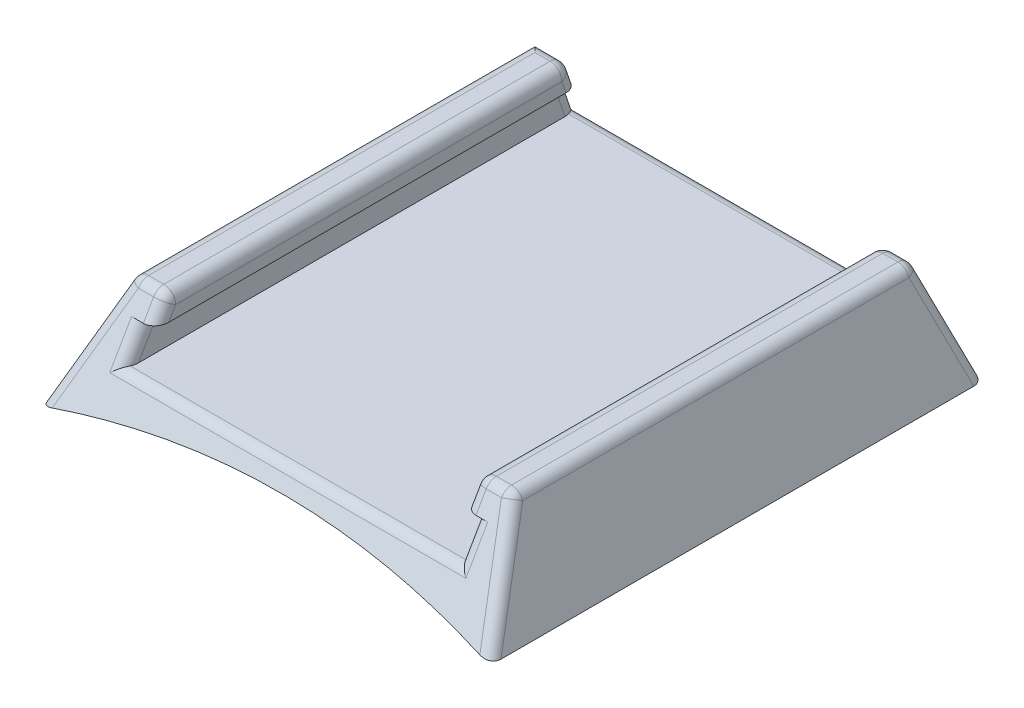
from build123d import *

# Parameters (mm, degrees)
BOSS_EXTRUDE1_DEPTH = 42
CUT_EXTRUDE2_DEPTH  = 58.425262324
FILLET1_R           = 1


with BuildPart() as part:
    # Sketch1 → Boss-Extrude1 (new body)
    with BuildSketch(Plane.XY):
        with BuildLine():
            Line((0, 0), (3, 8.626746371))
            Line((3, 8.626746371), (6, 8.626746371))
            Line((6, 8.626746371), (6, 6.626746371))
            Line((6, 6.626746371), (5, 6.626746371))
            Line((5, 6.626746371), (5, 3.926746371))
            Line((5, 3.926746371), (33.2, 3.926746371))
            Line((33.2, 3.926746371), (33.2, 6.626746371))
            Line((33.2, 6.626746371), (32.2, 6.626746371))
            Line((32.2, 6.626746371), (32.2, 8.626746371))
            Line((32.2, 8.626746371), (35.2, 8.626746371))
            Line((35.2, 8.626746371), (38.2, 0))
            ThreePointArc((38.2, 0), (19.1, 2.426746371), (0, 0))
        make_face()
    extrude(amount=BOSS_EXTRUDE1_DEPTH)

    # Sketch5 → Cut-Extrude2 (cut, through all)
    with BuildSketch(Plane(origin=(0, 0, 0), x_dir=(0, 0, -1), z_dir=(1, 0, 0))):
        Polygon((-42, 0), (-42, 8.626746371), (-37, 8.626746371), align=None)
        Polygon((0, 0), (0, 8.626746371), (-2.959406662, 8.626746371), align=None)
    extrude(amount=CUT_EXTRUDE2_DEPTH, mode=Mode.SUBTRACT)

    # Fillet1
    fillet1_edges = [part.edges().sort_by_distance(p)[0] for p in [
        (32.2, 7.626746371, 2.616356509),
        (33.2, 5.276746371, 1.81018865),
        (36.7, 4.313373185, 1.479703331),
        (33.7, 8.626746371, 2.959406662),
        (3, 8.626746371, 19.979703331),
        (4.5, 8.626746371, 2.959406662),
        (19.1, 3.926746371, 1.347070943),
        (5, 5.276746371, 1.81018865),
        (6, 7.626746371, 2.616356509),
        (36.7, 4.313373185, 39.5),
        (1.5, 4.313373185, 39.5),
        (35.2, 8.626746371, 19.979703331),
        (6, 8.626746371, 19.979703331),
        (4.5, 8.626746371, 37),
        (6, 7.626746371, 37.57959279),
        (5, 5.276746371, 38.941635847),
        (32.2, 8.626746371, 19.979703331),
        (33.7, 8.626746371, 37),
        (32.2, 7.626746371, 37.57959279),
        (33.2, 5.276746371, 38.941635847),
        (19.1, 3.926746371, 39.724086114),
    ]]
    fillet(fillet1_edges, radius=FILLET1_R - 0.0001)  # a hair under: the kernel refuses the full size


solid = part.part
